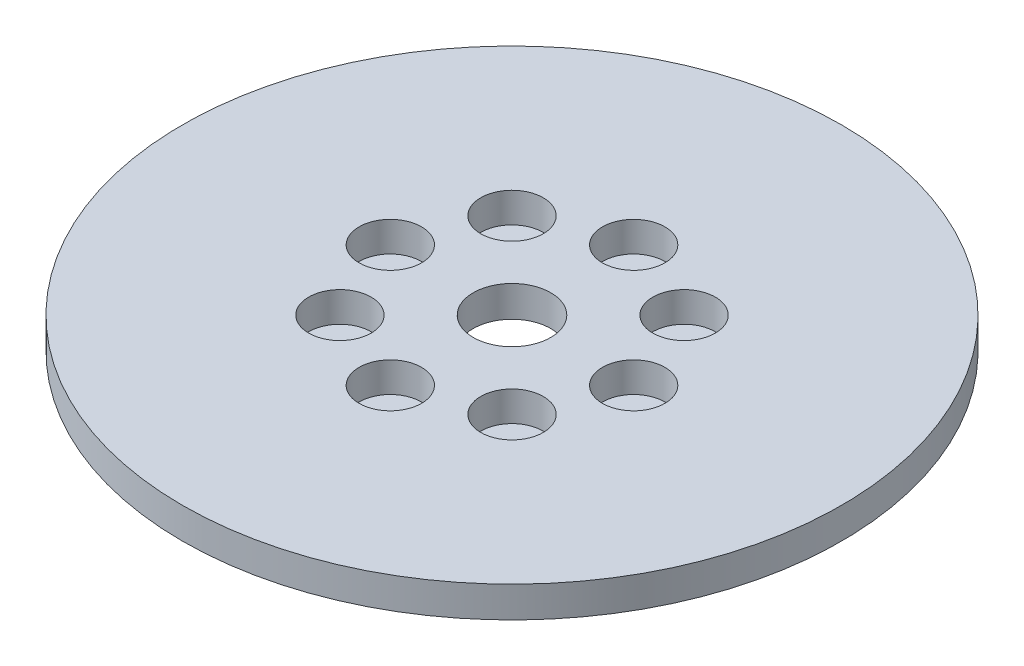
from build123d import *

# Parameters (mm, degrees)
SKETCH1_R           = 42.5
BOSS_EXTRUDE1_DEPTH = 4
SKETCH2_R           = 5
CUT_EXTRUDE1_DEPTH  = 61.237031799
SKETCH3_R           = 4.028837432
CUT_EXTRUDE2_DEPTH  = 3.872214821
CIRPATTERN1_COUNT   = 8


with BuildPart() as part:
    # Sketch1 → Boss-Extrude1 (new body)
    with BuildSketch(Plane(origin=(0, 0, 0), x_dir=(1, 0, 0), z_dir=(0, 1, 0))):
        Circle(SKETCH1_R)
    extrude(amount=BOSS_EXTRUDE1_DEPTH)

    # Sketch2 → Cut-Extrude1 (cut, through all)
    with BuildSketch(Plane(origin=(0, 0, 0), x_dir=(1, 0, 0), z_dir=(0, 1, 0))):
        Circle(SKETCH2_R)
    extrude(amount=CUT_EXTRUDE1_DEPTH, mode=Mode.SUBTRACT)

    # Sketch3 → Cut-Extrude2 (cut)
    with BuildSketch(Plane(origin=(0, 4, 0), x_dir=(1, 0, 0), z_dir=(0, 1, 0))):
        with Locations((-15.691767503, 0)):
            Circle(SKETCH3_R)
    cut_extrude2 = extrude(amount=-CUT_EXTRUDE2_DEPTH, mode=Mode.SUBTRACT)

    # CirPattern1: Cut-Extrude2 ×8 about axis
    cirpattern1_axis = Axis((0, 0, 0), (0, 1, 0))
    for i in range(1, CIRPATTERN1_COUNT):
        add(cut_extrude2.rotate(cirpattern1_axis, i * 360 / CIRPATTERN1_COUNT), mode=Mode.SUBTRACT)


solid = part.part
